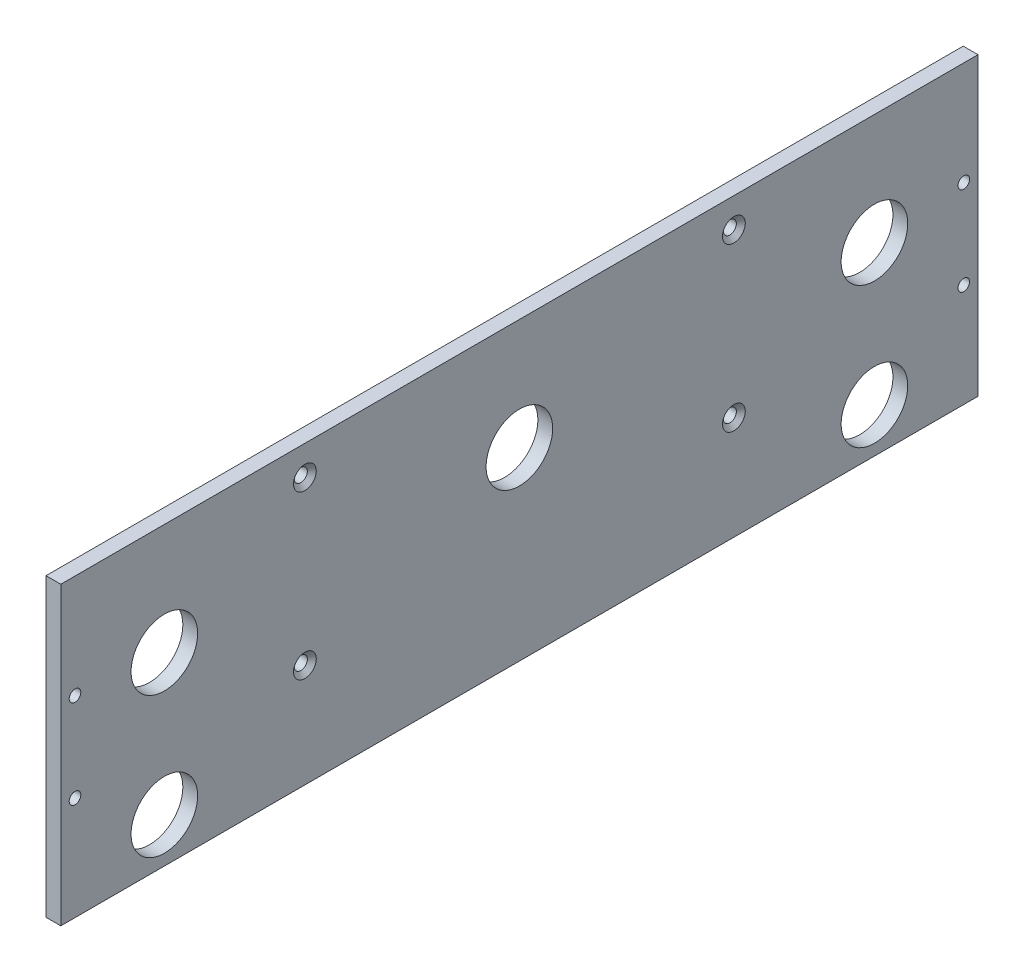
from build123d import *

# Parameters (mm, degrees)
SKETCH1_W                                          = 393.7
SKETCH1_H                                          = 127
BOSS_EXTRUDE1_DEPTH                                = 6.35
SKETCH2_R                                          = 14.2875
CUT_EXTRUDE1_DEPTH                                 = 207.935968357
F_10_CLEARANCE_HOLE1_D                             = 4.9784
CSK_FOR_10_FLAT_HEAD_MACHINE_SCREW_100_D           = 5.6134
CSK_FOR_10_FLAT_HEAD_MACHINE_SCREW_100_CSINK_D     = 9.779
CSK_FOR_10_FLAT_HEAD_MACHINE_SCREW_100_CSINK_ANGLE = 100


with BuildPart() as part:
    # Sketch1 → Boss-Extrude1 (new body)
    with BuildSketch(Plane(origin=(0, 0, 0), x_dir=(0, 0, -1), z_dir=(1, 0, 0))):
        Rectangle(SKETCH1_W, SKETCH1_H)
    extrude(amount=BOSS_EXTRUDE1_DEPTH)

    # Sketch2 → Cut-Extrude1 (cut, through all)
    with BuildSketch(Plane(origin=(6.35, 0, 0), x_dir=(0, 0, -1), z_dir=(1, 0, 0))):
        with Locations((0, 15.875)):
            Circle(SKETCH2_R)
        with Locations((-152.4, 15.875)):
            Circle(SKETCH2_R)
        with Locations((152.4, 15.875)):
            Circle(SKETCH2_R)
        with Locations((-152.4, -44.45)):
            Circle(SKETCH2_R)
        with Locations((152.4, -44.45)):
            Circle(SKETCH2_R)
    extrude(amount=-CUT_EXTRUDE1_DEPTH, mode=Mode.SUBTRACT)

    # #10 Clearance Hole1 (through all)
    with Locations(Plane(origin=(6.35, 0, 0), x_dir=(0, 0, -1), z_dir=(1, 0, 0))):
        with Locations((-190.754, 19.05), (-190.754, -19.05), (190.754, 19.05), (190.754, -19.05)):
            Hole(F_10_CLEARANCE_HOLE1_D / 2)

    # CSK for #10 Flat Head Machine Screw (100)1 (through all)
    with Locations(Plane(origin=(6.35, 0, 0), x_dir=(0, 0, -1), z_dir=(1, 0, 0))):
        with Locations((-92.075, 50.8), (92.075, 50.8), (-92.075, -19.05), (92.075, -19.05)):
            CounterSinkHole(CSK_FOR_10_FLAT_HEAD_MACHINE_SCREW_100_D / 2, CSK_FOR_10_FLAT_HEAD_MACHINE_SCREW_100_CSINK_D / 2, counter_sink_angle=CSK_FOR_10_FLAT_HEAD_MACHINE_SCREW_100_CSINK_ANGLE)


solid = part.part
